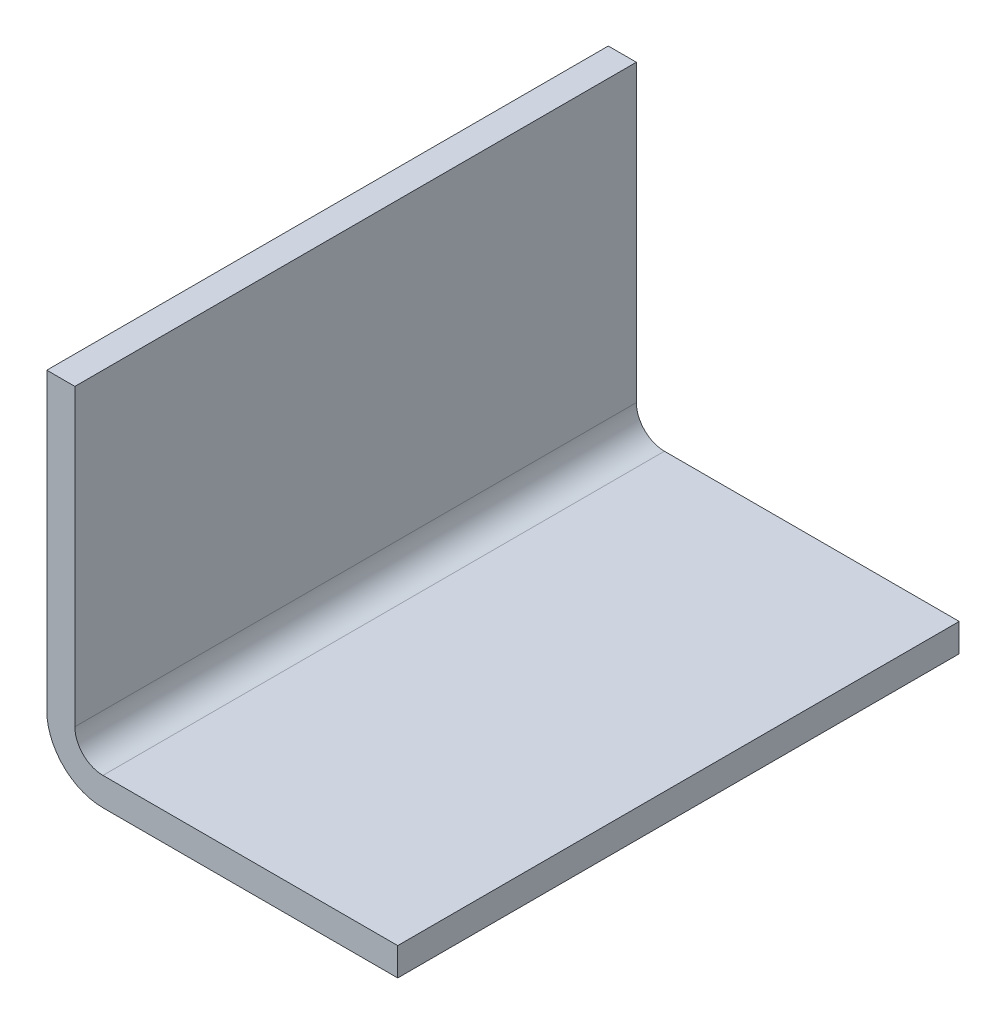
from build123d import *

# Parameters (mm, degrees)
BOSS_EXTRUDE1_DEPTH = 20


with BuildPart() as part:
    # Sketch1 → Boss-Extrude1 (new, symmetric)
    with BuildSketch(Plane.XY):
        with BuildLine():
            Line((0, 4), (0, 25))
            Line((0, 25), (2, 25))
            Line((2, 25), (2, 4))
            ThreePointArc((2, 4), (2.585786438, 2.585786438), (4, 2))
            Line((4, 2), (25, 2))
            Line((25, 2), (25, 0))
            Line((25, 0), (4, 0))
            ThreePointArc((4, 0), (1.171572875, 1.171572875), (0, 4))
        make_face()
    extrude(amount=BOSS_EXTRUDE1_DEPTH, both=True)


solid = part.part
